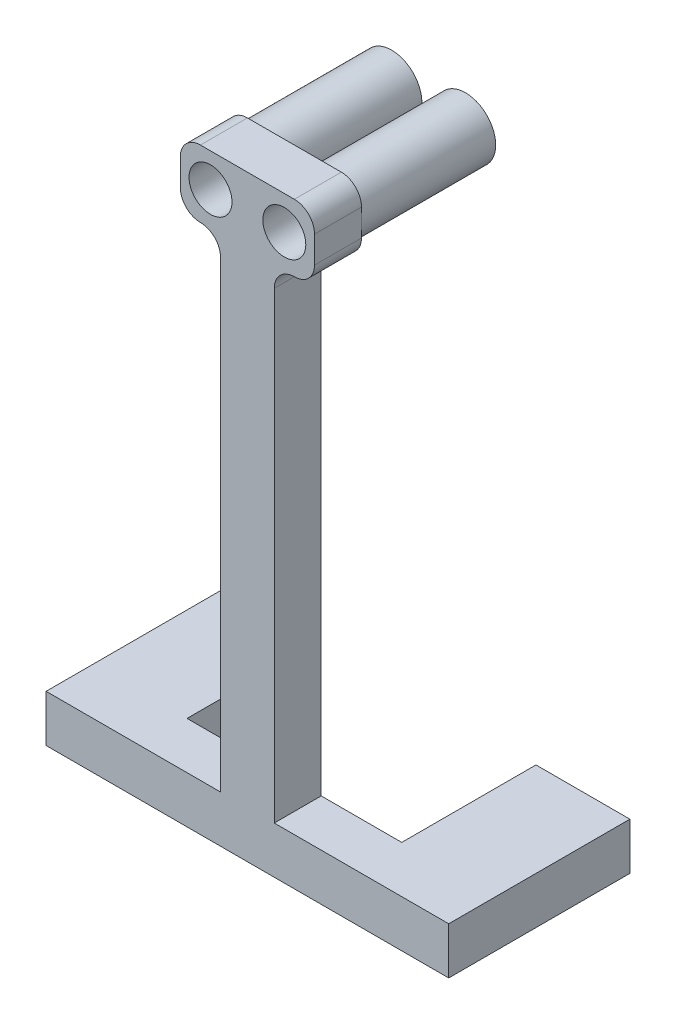
from build123d import *

# Parameters (mm, degrees)
SKETCH1_W           = 10.16
SKETCH1_H           = 91.44
SKETCH1_R           = 4.064
SKETCH1_W_2         = 76.2
SKETCH1_H_2         = 8.89
BOSS_EXTRUDE1_DEPTH = 8.89
SKETCH2_R           = 5.715
BOSS_EXTRUDE2_DEPTH = 25.4
SKETCH3_R           = 4.445
CUT_EXTRUDE1_DEPTH  = 25.4
FILLET1_R           = 3.81
SKETCH4_W           = 17.78
SKETCH4_H           = 8.89
BOSS_EXTRUDE3_DEPTH = 25.4


with BuildPart() as part:
    # Sketch1 → Boss-Extrude1 (new body)
    # profile 1 of 3: a face of its own
    with BuildSketch(Plane.XY):
        with Locations((0, 50.165)):
            Rectangle(SKETCH1_W, SKETCH1_H)
    # profile 2 of 3: a face of its own
    with BuildSketch(Plane.XY):
        Polygon((-12.7, 95.885), (-5.08, 95.885), (5.08, 95.885), (12.7, 95.885), (12.7, 108.585), (-12.7, 108.585), align=None)
        with Locations((-6.985, 102.235)):
            Circle(SKETCH1_R, mode=Mode.SUBTRACT)
        with Locations((6.985, 102.235)):
            Circle(SKETCH1_R, mode=Mode.SUBTRACT)
    # profile 3 of 3: a face of its own
    with BuildSketch(Plane.XY):
        Rectangle(SKETCH1_W_2, SKETCH1_H_2)
    extrude(amount=BOSS_EXTRUDE1_DEPTH)

    # Sketch2 → Boss-Extrude2 (add)
    with BuildSketch(Plane(origin=(0, 0, 0), x_dir=(-1, 0, 0), z_dir=(0, 0, -1))):
        with Locations((6.985, 102.235)):
            Circle(SKETCH2_R)
        with Locations(Location((-6.985, 102.235, 0), (0, 0, 180))):
            Circle(SKETCH2_R)
    extrude(amount=BOSS_EXTRUDE2_DEPTH)

    # Sketch3 → Cut-Extrude1 (cut)
    with BuildSketch(Plane(origin=(0, 0, -25.4), x_dir=(-1, 0, 0), z_dir=(0, 0, -1))):
        with Locations((6.985, 102.235)):
            Circle(SKETCH3_R)
        with Locations((-6.985, 102.235)):
            Circle(SKETCH3_R)
    extrude(amount=-CUT_EXTRUDE1_DEPTH, mode=Mode.SUBTRACT)

    # Fillet1
    fillet1_edges = [part.edges().sort_by_distance(p)[0] for p in [
        (-5.08, 95.885, 4.445),
        (-12.7, 95.885, 4.445),
        (5.08, 95.885, 4.445),
        (12.7, 95.885, 4.445),
        (12.7, 108.585, 4.445),
        (-12.7, 108.585, 4.445),
    ]]
    fillet(fillet1_edges, radius=FILLET1_R - 0.0001)  # a hair under: the kernel refuses the full size

    # Sketch4 → Boss-Extrude3 (add)
    with BuildSketch(Plane(origin=(0, 0, 0), x_dir=(-1, 0, 0), z_dir=(0, 0, -1))):
        with Locations((-29.21, 0)):
            Rectangle(SKETCH4_W, SKETCH4_H)
        with Locations((29.21, 0)):
            Rectangle(SKETCH4_W, SKETCH4_H)
    extrude(amount=BOSS_EXTRUDE3_DEPTH)


solid = part.part
